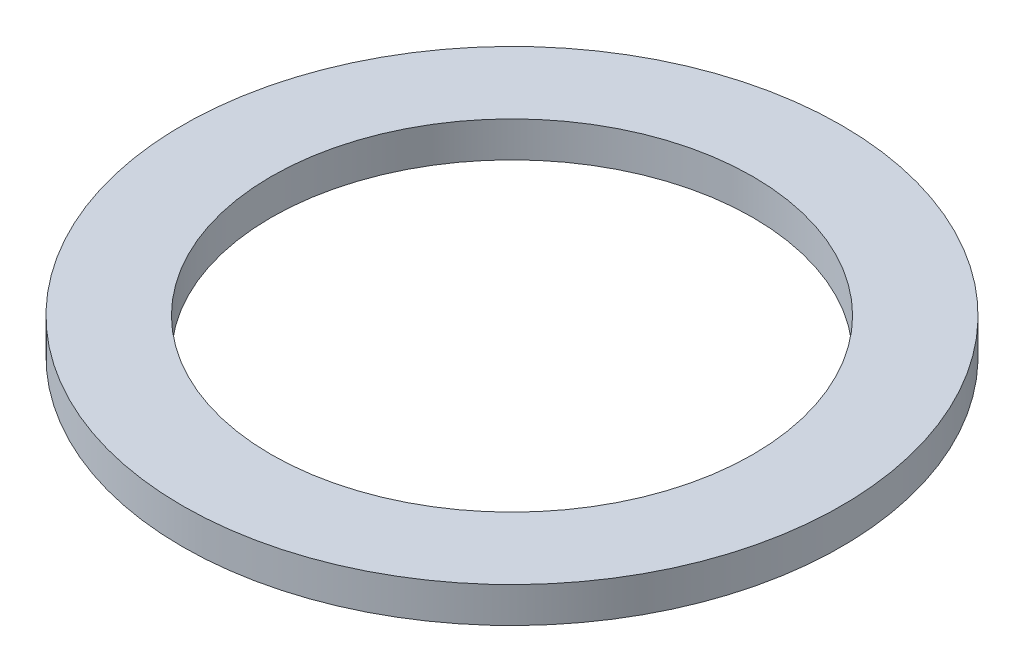
from build123d import *

# Parameters (mm, degrees)
SKETCH1_R           = 65
BOSS_EXTRUDE1_DEPTH = 7
SKETCH2_R           = 47.5
CUT_EXTRUDE1_DEPTH  = 93.190021152


with BuildPart() as part:
    # Sketch1 → Boss-Extrude1 (new body)
    with BuildSketch(Plane(origin=(0, 0, 0), x_dir=(1, 0, 0), z_dir=(0, 1, 0))):
        Circle(SKETCH1_R)
    extrude(amount=BOSS_EXTRUDE1_DEPTH)

    # Sketch2 → Cut-Extrude1 (cut, through all)
    with BuildSketch(Plane(origin=(0, 0, 0), x_dir=(1, 0, 0), z_dir=(0, 1, 0))):
        Circle(SKETCH2_R)
    extrude(amount=CUT_EXTRUDE1_DEPTH, mode=Mode.SUBTRACT)


solid = part.part
